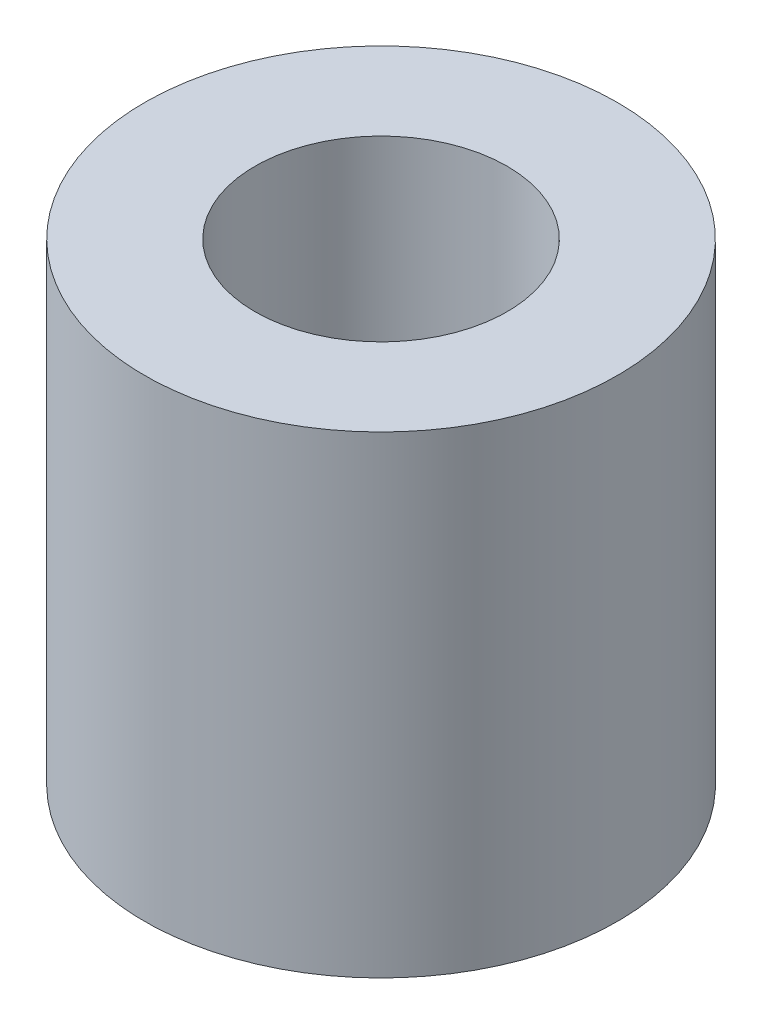
from build123d import *

# Parameters (mm, degrees)
SKETCH1_R           = 4.7625
SKETCH1_R_2         = 2.54
BOSS_EXTRUDE1_DEPTH = 9.525


with BuildPart() as part:
    # Sketch1 → Boss-Extrude1 (new body)
    with BuildSketch(Plane(origin=(0, 0, 0), x_dir=(1, 0, 0), z_dir=(0, 1, 0))):
        Circle(SKETCH1_R)
        Circle(SKETCH1_R_2, mode=Mode.SUBTRACT)
    extrude(amount=BOSS_EXTRUDE1_DEPTH)


solid = part.part
